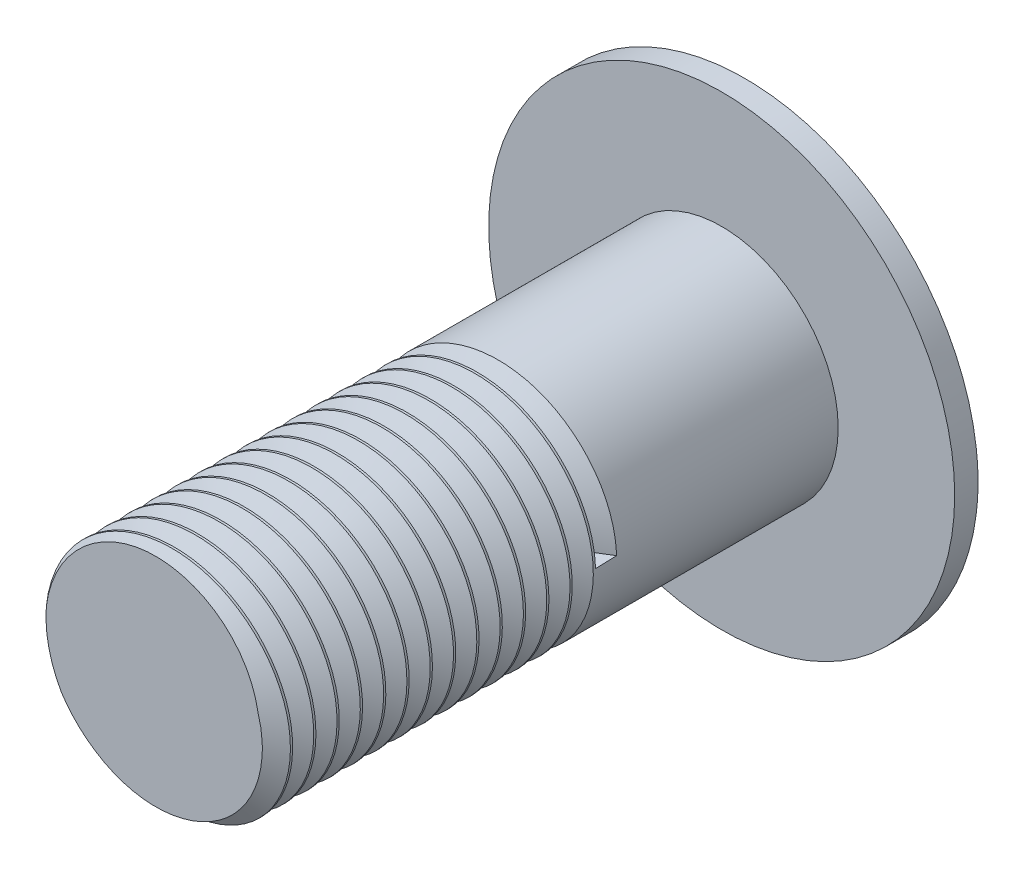
from build123d import *

# Parameters (mm, degrees)
SKETCH1_R           = 2.5
BOSS_EXTRUDE1_DEPTH = 12
SKETCH4_W           = 11.031864246
SKETCH4_H           = 1.25
CUT_EXTRUDE1_DEPTH  = 2
CUT_SWEEP1_PITCH    = 0.5


with BuildPart() as part:
    # Sketch1 → Boss-Extrude1 (new body)
    with BuildSketch(Plane.XY):
        Circle(SKETCH1_R)
    extrude(amount=BOSS_EXTRUDE1_DEPTH)

    # Sketch2 → Revolve2 (revolve)
    with BuildSketch(Plane(origin=(0, 0, 0), x_dir=(0, 0, -1), z_dir=(1, 0, 0)), mode=Mode.PRIVATE) as revolve2_sk:
        with BuildLine():
            Line((0, 0), (0, 5))
            Line((0, 5), (0.5, 5))
            add(Edge.make_bspline(
                [(1.827762538, 0), (1.827762538, 1.830149357), (1.519553174, 3.428686124), (0.5, 5)],
                knots=[0, 0, 0, 0, 1, 1, 1, 1], degree=3))
            Line((1.827762538, 0), (0, 0))
        make_face()
    revolve(revolve2_sk.sketch.rotate(Axis((0, 0, 0), (0, 0, -1)), 90), axis=Axis((0, 0, 0), (0, 0, -1)))

    # Sketch4 → Cut-Extrude1 (cut)
    with BuildSketch(Plane.XY.offset(-0.5)):
        with Locations((-0.041796822, 0)):
            Rectangle(SKETCH4_W, SKETCH4_H)
    extrude(amount=-CUT_EXTRUDE1_DEPTH, mode=Mode.SUBTRACT)

    # Cut-Sweep1: arcs per turn and ends read off the stored shape
    # Cut-Sweep1: the profile of Sketch6 screwed along a right-hand helix through 15 turns, 6 arcs to a turn; built about Z, then put on its axis
    cut_sweep1_z = Axis((0, 0, 0), (0, 0, 1))
    cut_sweep1_corners = [(2.108117864, -0.000567395, -0.482174766), (2.523810058, -0.008202965, -0.242296259), (2.523810058, 0.007068175, -0.722053273)]
    with BuildLine(mode=Mode.PRIVATE) as cut_sweep1_profile:
        Line(cut_sweep1_corners[0], cut_sweep1_corners[1])
        Line(cut_sweep1_corners[1], cut_sweep1_corners[2])
        Line(cut_sweep1_corners[2], cut_sweep1_corners[0])
    cut_sweep1_cap = Face(cut_sweep1_profile.wire())
    cut_sweep1_turn_angles = [0, 30, 60, 90, 120, 150, 180, 210, 240, 270, 300, 330, 360]
    cut_sweep1_turn_weights = [1, 0.8660254037844387, 1, 0.8660254037844387, 1, 0.8660254037844387, 1, 0.8660254037844387, 1, 0.8660254037844387, 1, 0.8660254037844387, 1]
    cut_sweep1_turn_rails = [Edge.make_bspline([Vector(p[0], p[1], 0).rotate(cut_sweep1_z, cut_sweep1_turn_angles[k]) / cut_sweep1_turn_weights[k] + Vector(0, 0, p[2] + CUT_SWEEP1_PITCH * cut_sweep1_turn_angles[k] / 360) for k in range(13)], [0, 0, 0, 1, 1, 2, 2, 3, 3, 4, 4, 5, 5, 6, 6, 6], 2, cut_sweep1_turn_weights) for p in cut_sweep1_corners]
    cut_sweep1_turn_sides = [Face.make_surface_from_curves(cut_sweep1_turn_rails[p[0]], cut_sweep1_turn_rails[p[1]]) for p in [(0, 1), (1, 2), (2, 0)]]
    cut_sweep1 = Plane(origin=(0, 0, 12), x_dir=(1, 0, 0), z_dir=(0, 0, -1)) * Solid(Shell([*[p.moved(Location((0, 0, CUT_SWEEP1_PITCH * i))) for i in range(15) for p in cut_sweep1_turn_sides], cut_sweep1_cap, cut_sweep1_cap.rotate(cut_sweep1_z, 5400).moved(Location((0, 0, CUT_SWEEP1_PITCH * 5400 / 360)))]))
    add(cut_sweep1, mode=Mode.SUBTRACT)


solid = part.part
